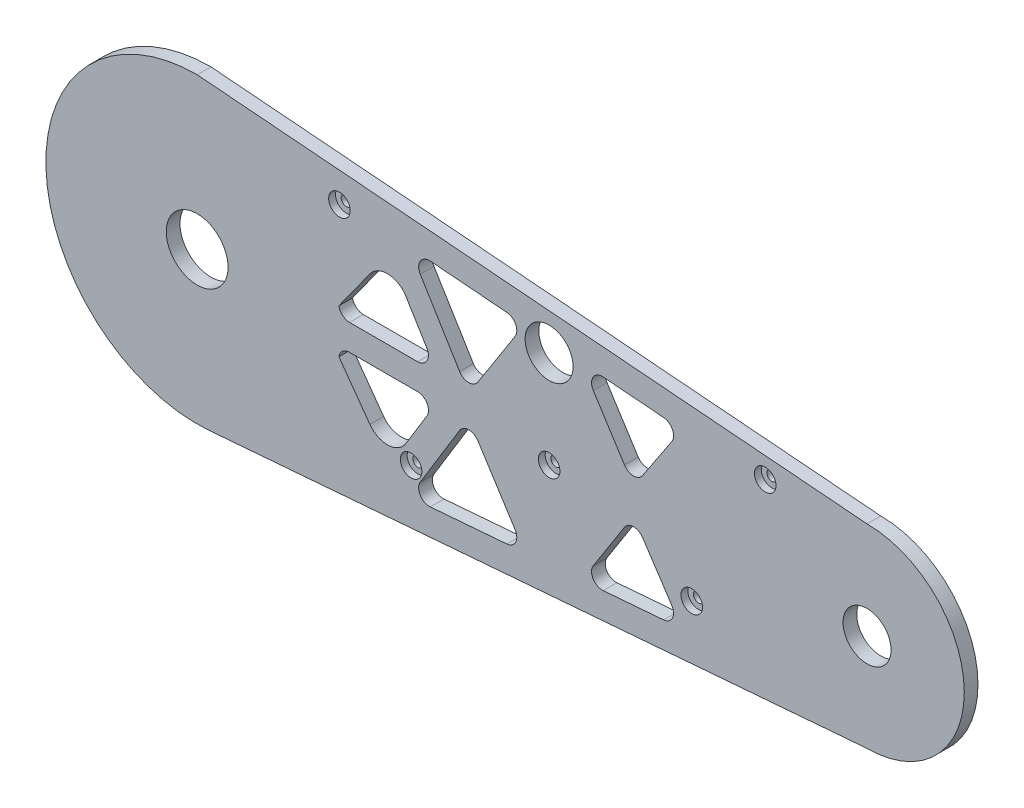
from build123d import *

# Parameters (mm, degrees)
SKETCH1_R             = 14.29385
SKETCH1_R_2           = 11.116
SKETCH1_R_3           = 11.1125
BOSS_EXTRUDE1_DEPTH   = 6.35
CROQUIS1_R            = 2.38125
CORTAR_EXTRUIR1_DEPTH = 50
CROQUIS6_R            = 2.38125
CORTAR_EXTRUIR4_DEPTH = 10
CROQUIS7_R            = 2.38125
CORTAR_EXTRUIR5_DEPTH = 10
CROQUIS9_R            = 5
CORTAR_EXTRUIR6_DEPTH = 3.18


with BuildPart() as part:
    # Sketch1 → Boss-Extrude1 (new body)
    with BuildSketch(Plane.XY):
        with BuildLine():
            Line((0, 70), (310, 45))
            ThreePointArc((310, 45), (355, 0), (310, -45))
            Line((310, -45), (5.171398252, -69.808714643))
            ThreePointArc((5.171398252, -69.808714643), (-69.952162315, -2.587467389), (0, 70))
        make_face()
        Circle(SKETCH1_R, mode=Mode.SUBTRACT)
        with Locations((310, 0)):
            Circle(SKETCH1_R_2, mode=Mode.SUBTRACT)
        with Locations((162.878542763, 40)):
            Circle(SKETCH1_R_3, mode=Mode.SUBTRACT)
        with BuildLine():
            Line((107.898974887, 49.259511156), (143.314248041, 46.40344074))
            ThreePointArc((143.314248041, 46.40344074), (147.389908855, 43.644764005), (147.127454118, 38.730252238))
            Line((147.127454118, 38.730252238), (129.916226305, 11.754586611))
            ThreePointArc((129.916226305, 11.754586611), (125.651076231, 9.444205574), (121.433006579, 11.839462159))
            Line((121.433006579, 11.839462159), (103.228961238, 41.671198203))
            ThreePointArc((103.228961238, 41.671198203), (103.238833139, 46.896293531), (107.898974887, 49.259511156))
        make_face(mode=Mode.SUBTRACT)
        with BuildLine():
            Line((70.523244027, 6), (102.03004784, 6))
            ThreePointArc((102.03004784, 6), (106.3902351, 8.552804247), (106.298140539, 13.604493178))
            Line((106.298140539, 13.604493178), (96.590354482, 29.513051181))
            ThreePointArc((96.590354482, 29.513051181), (88.437172177, 34.296727565), (79.941746192, 30.151166228))
            Line((79.941746192, 30.151166228), (65.58297828, 10.229432452))
            ThreePointArc((65.58297828, 10.229432452), (67.271539685, 7.201787411), (70.523244027, 6))
        make_face(mode=Mode.SUBTRACT)
        with BuildLine():
            Line((219.623774494, 32.810522613), (206.130928429, 12.417497436))
            ThreePointArc((206.130928429, 12.417497436), (201.919524559, 10.176643248), (197.745901529, 12.48710226))
            Line((197.745901529, 12.48710226), (183.296864227, 35.133505128))
            ThreePointArc((183.296864227, 35.133505128), (183.227765467, 40.400743015), (187.913912204, 42.80669363))
            Line((187.913912204, 42.80669363), (215.855795571, 40.553315939))
            ThreePointArc((215.855795571, 40.553315939), (219.949772588, 37.757395035), (219.623774494, 32.810522613))
        make_face(mode=Mode.SUBTRACT)
        with BuildLine():
            Line((96.590354482, -29.513051181), (106.298140539, -13.604493178))
            ThreePointArc((106.298140539, -13.604493178), (106.3902351, -8.552804247), (102.03004784, -6))
            Line((102.03004784, -6), (70.523244027, -6))
            ThreePointArc((70.523244027, -6), (67.271539685, -7.201787411), (65.58297828, -10.229432452))
            Line((65.58297828, -10.229432452), (79.941746192, -30.151166228))
            ThreePointArc((79.941746192, -30.151166228), (88.437172177, -34.296727565), (96.590354482, -29.513051181))
        make_face(mode=Mode.SUBTRACT)
        with BuildLine():
            Line((187.913912204, -42.80669363), (215.855795571, -40.553315939))
            ThreePointArc((215.855795571, -40.553315939), (219.949772588, -37.757395035), (219.623774494, -32.810522613))
            Line((219.623774494, -32.810522613), (206.130928429, -12.417497436))
            ThreePointArc((206.130928429, -12.417497436), (201.919524559, -10.176643248), (197.745901529, -12.48710226))
            Line((197.745901529, -12.48710226), (183.296864227, -35.133505128))
            ThreePointArc((183.296864227, -35.133505128), (183.227765467, -40.400743015), (187.913912204, -42.80669363))
        make_face(mode=Mode.SUBTRACT)
        with BuildLine():
            Line((121.433006579, -11.839462159), (103.228961238, -41.671198203))
            ThreePointArc((103.228961238, -41.671198203), (103.238833139, -46.896293531), (107.898974887, -49.259511156))
            Line((107.898974887, -49.259511156), (143.314248041, -46.40344074))
            ThreePointArc((143.314248041, -46.40344074), (147.389908855, -43.644764005), (147.127454118, -38.730252238))
            Line((147.127454118, -38.730252238), (129.916226305, -11.754586611))
            ThreePointArc((129.916226305, -11.754586611), (125.651076231, -9.444205574), (121.433006579, -11.839462159))
        make_face(mode=Mode.SUBTRACT)
    extrude(amount=BOSS_EXTRUDE1_DEPTH)

    # Croquis1 → Cortar-Extruir1 (cut)
    with BuildSketch(Plane.XY.offset(6.35)):
        with Locations((98.995555235, -37.090103176)):
            Circle(CROQUIS1_R)
        with Locations((228.877351461, -26.519571404)):
            Circle(CROQUIS1_R)
    extrude(amount=-CORTAR_EXTRUIR1_DEPTH, mode=Mode.SUBTRACT)

    # Croquis6 → Cortar-Extruir4 (cut)
    with BuildSketch(Plane(origin=(0, 0, 0), x_dir=(-1, 0, 0), z_dir=(0, 0, -1))):
        with Locations((-162.878542763, -5)):
            Circle(CROQUIS6_R)
    extrude(amount=-CORTAR_EXTRUIR4_DEPTH, mode=Mode.SUBTRACT)

    # Croquis7 → Cortar-Extruir5 (cut)
    with BuildSketch(Plane(origin=(0, 0, 0), x_dir=(-1, 0, 0), z_dir=(0, 0, -1))):
        with Locations((-65.84135797, 50.868973694)):
            Circle(CROQUIS7_R)
        with Locations((-262.871569638, 39.210126075)):
            Circle(CROQUIS7_R)
    extrude(amount=-CORTAR_EXTRUIR5_DEPTH, mode=Mode.SUBTRACT)

    # Croquis9 → Cortar-Extruir6 (cut)
    with BuildSketch(Plane.XY.offset(6.35)):
        with Locations((65.84135797, 50.868973694)):
            Circle(CROQUIS9_R)
        with Locations((162.878542763, -5)):
            Circle(CROQUIS9_R)
        with Locations((98.995555235, -37.090103176)):
            Circle(CROQUIS9_R)
        with Locations((228.877351461, -26.519571404)):
            Circle(CROQUIS9_R)
        with Locations((262.871569638, 39.210126075)):
            Circle(CROQUIS9_R)
    extrude(amount=-CORTAR_EXTRUIR6_DEPTH, mode=Mode.SUBTRACT)


solid = part.part
